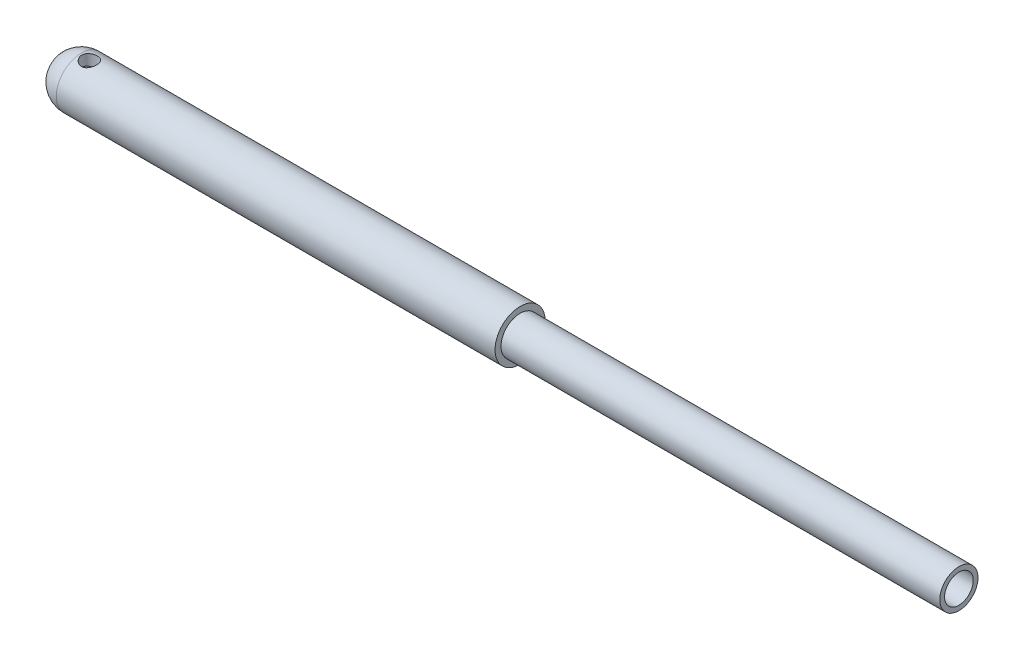
from build123d import *
from build123d.topology import SkipClean

# Parameters (mm, degrees)
SWEEP1_PROFILE_R   = 152.4
SWEEP2_PROFILE_R   = 200
SKETCH99_R         = 114.3
CUT_EXTRUDE1_DEPTH = 7000
SKETCH140_R        = 63.5
CUT_EXTRUDE2_DEPTH = 1750


with BuildPart() as part:
    # Sweep1: sweep along a path in Sketch2
    with BuildLine(Plane(origin=(1e-09, 13182.61759136, 0), x_dir=(1, 0, 0), z_dir=(0, 1, 0))) as sweep1_path:
        Line((23740.501936611, 2266.384637986), (30740.501936611, 2266.384637986))
    # Sweep1 profile (on start of the path) → Sweep1 (sweep)
    with BuildSketch(Plane(origin=(23740.501936612, 13182.617591358, -2266.384637986), x_dir=(0, 1, 0), z_dir=(1, 0, 0))):
        Circle(SWEEP1_PROFILE_R)
    sweep(path=sweep1_path.line)

    # Sweep2: sweep along a path in Sketch31
    with BuildLine(Plane(origin=(1e-09, 13182.61759136, 0), x_dir=(1, 0, 0), z_dir=(0, 1, 0))) as sweep2_path:
        Line((23740.501936611, 2266.384637986), (27240.501936611, 2266.384637986))
    # Sweep2 profile (on start of the path) → Sweep2 (sweep)
    with BuildSketch(Plane(origin=(23740.501936612, 13182.617591358, -2266.384637986), x_dir=(0, 1, 0), z_dir=(1, 0, 0))):
        Circle(SWEEP2_PROFILE_R)
    sweep(path=sweep2_path.line)

    # Sketch66 → Revolve4 (revolve)
    with SkipClean():  # the faces are left unmerged after this step: merging them gives an invalid solid
        with BuildSketch(Plane(origin=(1e-09, 13182.61759136, 0), x_dir=(1, 0, 0), z_dir=(0, 1, 0))):
            with BuildLine():
                Line((23740.501936611, 2466.384637986), (23740.501936611, 2066.384637986))
                ThreePointArc((23740.501936611, 2066.384637986), (23540.501936611, 2266.384637986), (23740.501936611, 2466.384637986))
            make_face()
        revolve(axis=Axis((23740.501936612, 13182.617591358, -2466.384637986), (0, 0, 1)))

    # Sketch99 → Cut-Extrude1 (cut)
    with SkipClean():  # the faces are left unmerged after this step: merging them gives an invalid solid
        with BuildSketch(Plane(origin=(30740.501936611, -2e-09, 0), x_dir=(0, 0, -1), z_dir=(1, 0, 0))):
            with Locations((2266.384637986, 13182.61759136)):
                Circle(SKETCH99_R)
        extrude(amount=-CUT_EXTRUDE1_DEPTH, mode=Mode.SUBTRACT)

    # Sketch140 → Cut-Extrude2 (cut, symmetric)
    with SkipClean():  # the faces are left unmerged after this step: merging them gives an invalid solid
        with BuildSketch(Plane(origin=(187.795896922, 14236.037369872, -4220.063365883), x_dir=(0.9846757772381061, -1.714887253549652e-14, 0.1743949933929635), z_dir=(0, -1, 0))):
            with Locations((23612.126841123, -2183.733894313)):
                Circle(SKETCH140_R)
        extrude(amount=CUT_EXTRUDE2_DEPTH, both=True, mode=Mode.SUBTRACT)


solid = part.part
